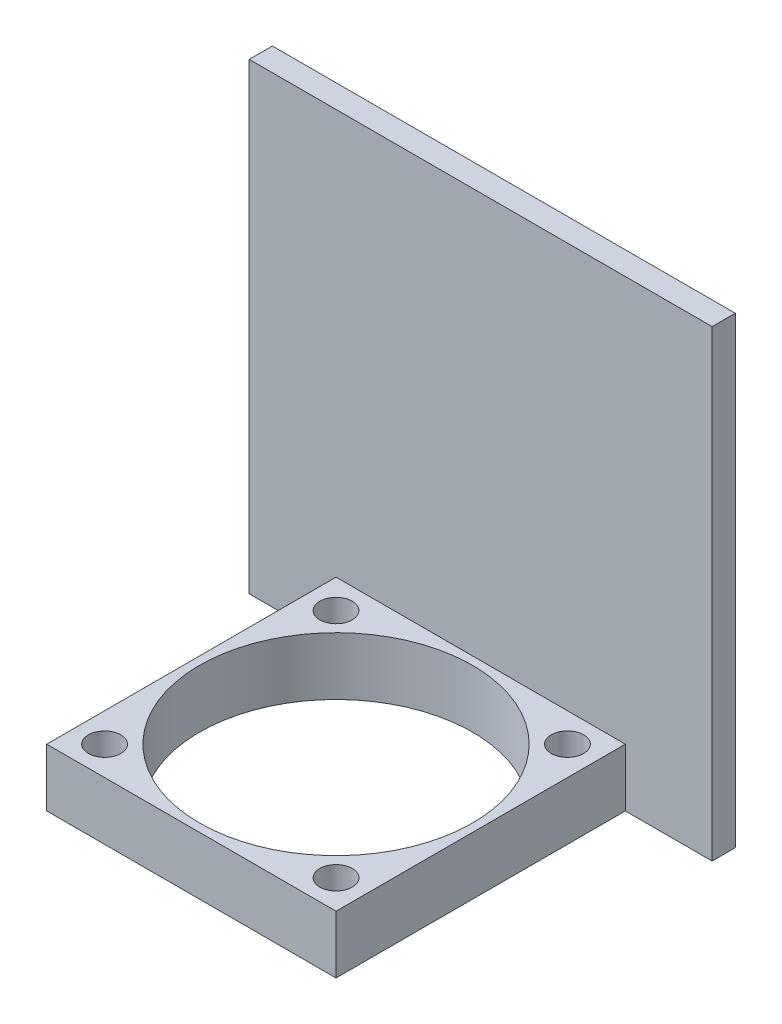
from build123d import *

# Parameters (mm, degrees)
SKETCH2_W               = 5
SKETCH2_H               = 25
BOSS_EXTRUDE1_DEPTH     = 25
SKETCH2_3_W             = 40
SKETCH2_3_H             = 40
BOSS_EXTRUDE2_DEPTH     = 2
CUT_EXTRUDE1_DEPTH      = 52.23475383
CUT_EXTRUDE1_DEPTH_BACK = 21
SKETCH3_R               = 11.8
SKETCH3_R_2             = 1.4


with BuildPart() as part:
    # Sketch2 → Boss-Extrude1 (new body)
    with BuildSketch(Plane(origin=(0, 0, 0), x_dir=(0, 1, 0), z_dir=(0, 0, 1))):
        with Locations((-17.5, 0)):
            Rectangle(SKETCH2_W, SKETCH2_H)
    extrude(amount=BOSS_EXTRUDE1_DEPTH)

    # Sketch2<3> → Boss-Extrude2 (add)
    with BuildSketch(Plane(origin=(0, 0, 0), x_dir=(0, 1, 0), z_dir=(0, 0, 1))):
        Rectangle(SKETCH2_3_W, SKETCH2_3_H)
    extrude(amount=-BOSS_EXTRUDE2_DEPTH)

    # Sketch3 → Cut-Extrude1 (cut, two sides: drawn at the far end of the back side and taken through both)
    with BuildSketch(Plane.XZ.offset(20).offset(-CUT_EXTRUDE1_DEPTH_BACK)):
        with Locations((0, 12.5)):
            Circle(SKETCH3_R)
        with Locations((-10, 22.5)):
            Circle(SKETCH3_R_2)
        with Locations((10, 22.5)):
            Circle(SKETCH3_R_2)
        with Locations((10, 2.5)):
            Circle(SKETCH3_R_2)
        with Locations((-10, 2.5)):
            Circle(SKETCH3_R_2)
    extrude(amount=CUT_EXTRUDE1_DEPTH + CUT_EXTRUDE1_DEPTH_BACK, mode=Mode.SUBTRACT)


solid = part.part
